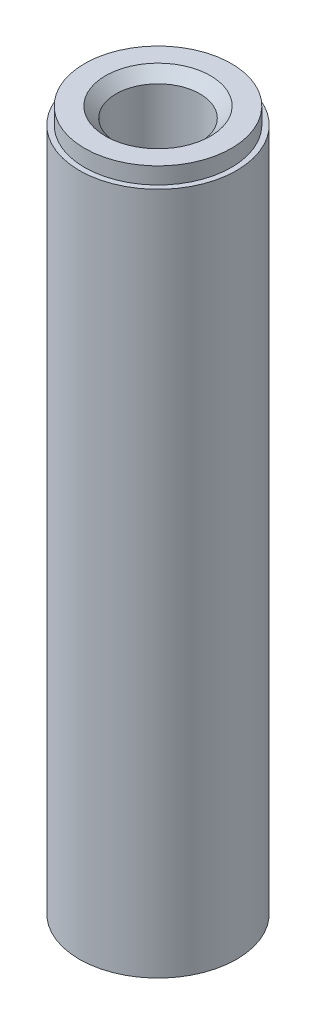
from build123d import *

# Parameters (mm, degrees)
SKETCH1_R           = 37.5
SKETCH1_R_2         = 20
BOSS_EXTRUDE1_DEPTH = 333.5
SKETCH2_R           = 57.290073323
SKETCH2_R_2         = 35
CUT_EXTRUDE1_DEPTH  = 7.9
CHAMFER2_SIZE       = 5


with BuildPart() as part:
    # Sketch1 → Boss-Extrude1 (new body)
    with BuildSketch(Plane(origin=(0, 0, 0), x_dir=(1, 0, 0), z_dir=(0, 1, 0))):
        Circle(SKETCH1_R)
        Circle(SKETCH1_R_2, mode=Mode.SUBTRACT)
    extrude(amount=BOSS_EXTRUDE1_DEPTH)

    # Sketch2 → Cut-Extrude1 (cut)
    with BuildSketch(Plane(origin=(0, 333.5, 0), x_dir=(1, 0, 0), z_dir=(0, 1, 0))):
        Circle(SKETCH2_R)
        Circle(SKETCH2_R_2, mode=Mode.SUBTRACT)
    extrude(amount=-CUT_EXTRUDE1_DEPTH, mode=Mode.SUBTRACT)

    # Chamfer2
    chamfer2_edges = [part.edges().sort_by_distance(p)[0] for p in [
        (-20, 333.5, 0),
    ]]
    chamfer(chamfer2_edges, length=CHAMFER2_SIZE)


solid = part.part
